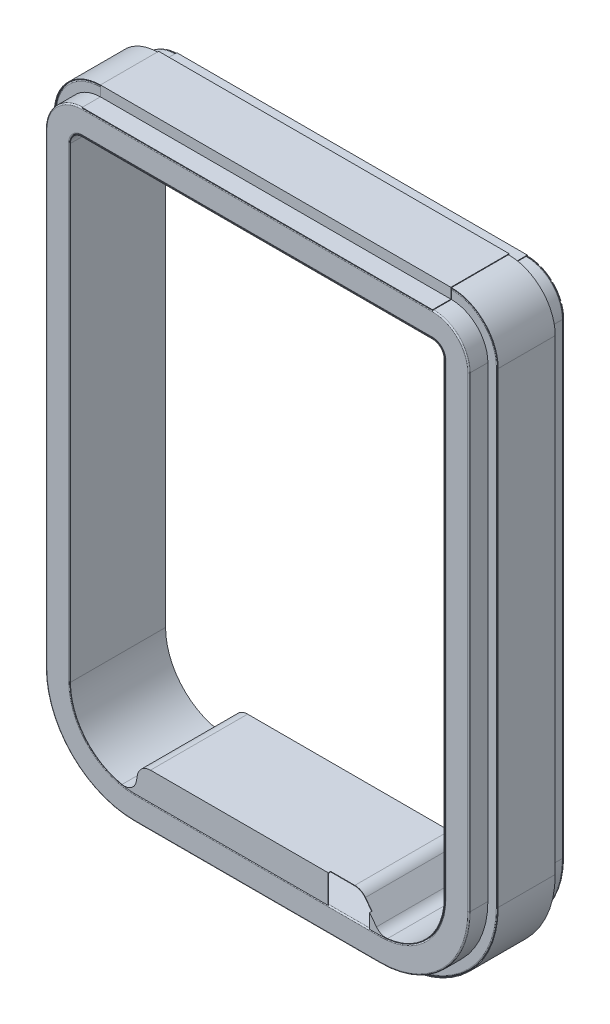
from build123d import *

# Parameters (mm, degrees)
BOSS_EXTRUDE4_DEPTH      = 4.7244
BOSS_EXTRUDE4_DEPTH_BACK = 5.1815999999999995
BOSS_EXTRUDE5_START      = -5.968999999999999
BOSS_EXTRUDE5_DEPTH      = 5.968999999999999
FILLET1_R                = 0.127
SKETCH4_W                = 0.5842
SKETCH4_H                = 0.1524000000000001
BOSS_EXTRUDE1_DEPTH      = 9.906
BOSS_EXTRUDE2_DEPTH      = 5.968999999999999
BOSS_EXTRUDE3_DEPTH      = 0.254
CUT_EXTRUDE1_DEPTH       = 0.254
EXTRUDE_THIN1_DEPTH      = 18.3388
FILLET6_R                = 1.27
FILLET7_R                = 1.27
CUT_EXTRUDE5_DEPTH       = 0.20320000000000002
FILLET11_R               = 1.3207999999999998
CUT_EXTRUDE6_DEPTH       = 0.1778
FILLET9_R                = 1.27
FILLET10_R               = 1.27
FILLET12_R               = 1.3208
FILLET13_R               = 1.3207999999999998
BOSS_EXTRUDE6_DEPTH      = 5.969
FILLET15_R               = 1.3208
BOSS_EXTRUDE7_START      = -0.0508
BOSS_EXTRUDE7_DEPTH      = 0.0508
SKETCH29_W               = 4.3288360759419255
SKETCH29_H               = 2.9608406959411457
CUT_EXTRUDE8_DEPTH       = 0.254


with BuildPart() as part:
    # Sketch15 → Boss-Extrude4 (new, two sides: drawn at the far end of the back side and taken through both)
    with BuildSketch(Plane.XY.offset(-BOSS_EXTRUDE4_DEPTH_BACK)):
        with BuildLine():
            Line((1.3716000000007786, 11.19492499805992), (1.37160000000078, 60.03912499805526))
            ThreePointArc((1.37160000000078, 60.03912499805526), (2.487523163680782, 62.73320183437779), (5.181600000003313, 63.84912499805778))
            Line((5.181600000003313, 63.84912499805778), (41.8591999999961, 63.84912499805778))
            ThreePointArc((41.8591999999961, 63.84912499805778), (44.553276836318645, 62.7332018343778), (45.669199999998646, 60.03912499805526))
            Line((45.669199999998646, 60.03912499805526), (45.669199999998646, 11.19492499805992))
            ThreePointArc((45.669199999998646, 11.19492499805992), (42.95378696837913, 4.63933802967944), (36.398199999998646, 1.9239249980599216))
            Line((36.398199999998646, 1.9239249980599216), (10.642600000000776, 1.9239249980599216))
            ThreePointArc((10.642600000000776, 1.9239249980599216), (4.087013031620294, 4.6393380296794415), (1.3716000000007786, 11.19492499805992))
        make_face()
        with BuildLine():
            Line((3.9115999999997113, 60.03912499805526), (3.9115999999997113, 11.19492499805992))
            ThreePointArc((3.9115999999997113, 11.19492499805992), (5.883064255833371, 6.435389253892517), (10.642600000000774, 4.463924998058857))
            Line((10.642600000000774, 4.463924998058857), (36.398199999998646, 4.463924998058857))
            ThreePointArc((36.398199999998646, 4.463924998058857), (41.15773574416605, 6.4353892538925175), (43.1291999999997, 11.19492499805992))
            Line((43.1291999999997, 11.19492499805992), (43.1291999999997, 60.03912499805526))
            ThreePointArc((43.1291999999997, 60.03912499805526), (42.75722561210556, 60.937150610164714), (41.8591999999961, 61.309124998058856))
            Line((41.8591999999961, 61.309124998058856), (5.181600000003313, 61.309124998058856))
            ThreePointArc((5.181600000003313, 61.309124998058856), (4.283574387893854, 60.937150610164714), (3.9115999999997113, 60.03912499805526))
        make_face(mode=Mode.SUBTRACT)
    extrude(amount=BOSS_EXTRUDE4_DEPTH + BOSS_EXTRUDE4_DEPTH_BACK)

    # Sketch16 → Boss-Extrude5 (add)
    with BuildSketch(Plane.XY.offset(2.7432000000000003).offset(BOSS_EXTRUDE5_START)):
        with BuildLine():
            Line((0.3556000000007834, 60.03912499805526), (0.3556000000007786, 11.194924998059921))
            ThreePointArc((0.3556000000007786, 11.194924998059921), (3.3685925419347615, 3.9209175399939094), (10.642600000000776, 0.9079249980599238))
            Line((10.642600000000776, 0.9079249980599238), (36.398199999998646, 0.9079249980599199))
            ThreePointArc((36.398199999998646, 0.9079249980599199), (43.67220745806466, 3.9209175399939067), (46.68519999999865, 11.194924998059921))
            Line((46.68519999999865, 11.194924998059921), (46.685199999998645, 60.03912499805526))
            ThreePointArc((46.685199999998645, 60.03912499805526), (45.27169732600418, 63.45162232406333), (41.8591999999961, 64.86512499805778))
            Line((41.8591999999961, 64.86512499805778), (5.181600000003313, 64.86512499805778))
            ThreePointArc((5.181600000003313, 64.86512499805778), (1.7691026739952513, 63.45162232406332), (0.3556000000007834, 60.03912499805526))
        make_face()
        with BuildLine():
            Line((41.8591999999961, 63.84912499805778), (5.181600000003313, 63.84912499805778))
            ThreePointArc((5.181600000003313, 63.84912499805778), (2.487523163680782, 62.73320183437779), (1.37160000000078, 60.03912499805526))
            Line((1.37160000000078, 60.03912499805526), (1.3716000000007786, 11.19492499805992))
            ThreePointArc((1.3716000000007786, 11.19492499805992), (4.087013031620294, 4.6393380296794415), (10.642600000000776, 1.9239249980599216))
            Line((10.642600000000776, 1.9239249980599216), (36.398199999998646, 1.92392499805992))
            ThreePointArc((36.398199999998646, 1.92392499805992), (42.95378696837913, 4.639338029679439), (45.669199999998646, 11.19492499805992))
            Line((45.669199999998646, 11.19492499805992), (45.66919999999864, 60.03912499805526))
            ThreePointArc((45.66919999999864, 60.03912499805526), (44.55327683631864, 62.733201834377795), (41.8591999999961, 63.84912499805778))
        make_face(mode=Mode.SUBTRACT)
    extrude(amount=BOSS_EXTRUDE5_DEPTH)

    # Fillet1
    fillet1_edges = [part.edges().sort_by_distance(p)[0] for p in [
        (42.95378696837913, 4.63933802967944, -5.1815999999999995),
        (1.7691026739952487, 63.451622324063315, 2.7432000000000003),
        (0.355600000000781, 35.61702499805759, 2.7432000000000003),
        (3.3685925419347615, 3.9209175399939067, 2.7432000000000003),
        (23.52039999999971, 0.9079249980599218, 2.7432000000000003),
        (43.67220745806466, 3.9209175399939067, 2.7432000000000003),
        (46.685199999998645, 35.61702499805759, 2.7432000000000003),
        (45.27169732600418, 63.45162232406333, 2.7432000000000003),
        (23.520399999999707, 64.86512499805778, 2.7432000000000003),
        (45.669199999998646, 35.61702499805759, -5.1815999999999995),
        (44.553276836318645, 62.733201834377795, -5.1815999999999995),
        (23.520399999999707, 63.84912499805778, -5.1815999999999995),
        (2.487523163680782, 62.73320183437779, -5.1815999999999995),
        (1.3716000000007793, 35.61702499805759, -5.1815999999999995),
        (4.283574387893855, 60.937150610164714, -5.1815999999999995),
        (23.520399999999707, 61.309124998058856, -5.1815999999999995),
        (42.75722561210556, 60.937150610164714, -5.1815999999999995),
        (43.1291999999997, 35.61702499805759, -5.1815999999999995),
        (41.15773574416605, 6.4353892538925175, -5.1815999999999995),
        (23.52039999999971, 4.463924998058857, -5.1815999999999995),
        (5.883064255833371, 6.435389253892516, -5.1815999999999995),
        (3.9115999999997113, 35.61702499805759, -5.1815999999999995),
        (4.0870130316202955, 4.63933802967944, -5.1815999999999995),
        (4.0870130316202955, 4.63933802967944, 4.7244),
        (23.52039999999971, 1.9239249980599216, 4.7244),
        (42.95378696837913, 4.63933802967944, 4.7244),
        (45.669199999998646, 35.61702499805759, 4.7244),
        (44.553276836318645, 62.733201834377795, 4.7244),
        (23.520399999999707, 63.84912499805778, 4.7244),
        (2.487523163680782, 62.73320183437779, 4.7244),
        (1.3716000000007793, 35.61702499805759, 4.7244),
        (4.283574387893855, 60.937150610164714, 4.7244),
        (3.9115999999997113, 35.61702499805759, 4.7244),
        (5.883064255833371, 6.435389253892516, 4.7244),
        (23.52039999999971, 4.463924998058857, 4.7244),
        (41.15773574416605, 6.4353892538925175, 4.7244),
        (43.1291999999997, 35.61702499805759, 4.7244),
        (42.75722561210556, 60.937150610164714, 4.7244),
        (23.520399999999707, 61.309124998058856, 4.7244),
        (23.52039999999971, 1.9239249980599216, -5.1815999999999995),
        (1.7691026739952487, 63.451622324063315, -3.225799999999999),
        (23.520399999999707, 64.86512499805778, -3.225799999999999),
        (45.27169732600418, 63.45162232406333, -3.225799999999999),
        (46.685199999998645, 35.61702499805759, -3.225799999999999),
        (43.67220745806466, 3.9209175399939067, -3.225799999999999),
        (23.52039999999971, 0.9079249980599218, -3.225799999999999),
        (3.3685925419347615, 3.9209175399939067, -3.225799999999999),
        (0.355600000000781, 35.61702499805759, -3.225799999999999),
    ]]
    fillet(fillet1_edges, radius=FILLET1_R)

    # Sweep1: sweep along a path in Sketch1
    with BuildLine() as sweep1_path:  # in the path sketch's own coordinates; laid on its plane below (add() does not lay a ready-made edge on the line's plane)
        add(Edge.make_bspline(
            [(23.5204, 0.7301249980627006), (4.876733945578098, 0.6234907723745157), (10.288008136508404, 0.5536080150748852), (8.118434294091632, 1.4309469259175354)],
            knots=[0, 0, 0, 0, 1, 1, 1, 1], degree=3))
    # Sketch2 → Sweep1 (sweep)
    with BuildSketch(Plane(origin=(23.520400000000002, 0.7301249980627008, -1.8796), x_dir=(0, 0, 1), z_dir=(-0.9999836435158218, -0.005719501798406666, 0))):
        Polygon((0.2921, -0.07619999999999998), (-0.29209999999999997, -0.07620000000000005), (-0.29209999999999997, 0.07619999999999993), (0.2921, 0.07620000000000003), align=None)
    sweep(path=Plane.XY.offset(-1.8796) * sweep1_path.line)

    # Sweep2: sweep along a path in Sketch3
    with BuildLine(Plane.XY.offset(-3.2512000000000003)) as sweep2_path:
        Line((28.1912, 5.064325118062801), (29.472500016994584, 5.064325118062801))
        ThreePointArc((29.472500016994584, 5.064325118062801), (30.62704291120851, 4.973598517206771), (31.75324281947112, 4.703645970798979))
        ThreePointArc((31.75324281947112, 4.703645970798979), (32.50175777951851, 4.524225320871167), (33.269110557648936, 4.4639249980628))
    # Sketch4 → Sweep2 (sweep)
    with BuildSketch(Plane(origin=(33.269110557648936, 0.7580041098484251, 0.10159999999999944), x_dir=(0, 0, 1), z_dir=(-1, 1.8e-16, 0))):
        with Locations((-3.3528, 3.7059208882143753)):
            Rectangle(SKETCH4_W, SKETCH4_H)
    sweep(path=sweep2_path.line)


with BuildPart() as body_2:
    # Sketch10 → Boss-Extrude1 (new body)
    with BuildSketch(Plane.XY.offset(4.7244)):
        with BuildLine():
            Line((36.373110157303266, 4.463971759490526), (34.544650972793214, 6.8472066344463265))
            ThreePointArc((34.544650972793214, 6.8472066344463265), (34.07203285071355, 7.23511523618504), (33.47658216175134, 7.373965694))
            Line((33.47658216175134, 7.373965694), (12.342341110152754, 7.373965694))
            ThreePointArc((12.342341110152754, 7.373965694), (11.48111051261952, 7.062432934165913), (11.018485686744414, 6.2720222351863715))
            Line((11.018485686744414, 6.2720222351863715), (10.68490915721032, 4.464057971054371))
            ThreePointArc((10.68490915721032, 4.464057971054371), (5.898046382280934, 6.42045414061447), (3.9115999999997113, 11.19492499805992))
            Line((3.9115999999997113, 11.19492499805992), (3.9115999999997113, 60.03912499805526))
            ThreePointArc((3.9115999999997113, 60.03912499805526), (4.283574387893854, 60.937150610164714), (5.181600000003313, 61.309124998058856))
            Line((5.181600000003313, 61.309124998058856), (41.8591999999961, 61.30912499805885))
            ThreePointArc((41.8591999999961, 61.30912499805885), (42.75722561210556, 60.937150610164714), (43.1291999999997, 60.03912499805526))
            Line((43.1291999999997, 60.03912499805526), (43.1291999999997, 11.19492499805992))
            ThreePointArc((43.1291999999997, 11.19492499805992), (41.14885686346667, 6.426526905870211), (36.373110157303266, 4.463971759490526))
        make_face()
        with BuildLine():
            Line((12.342341110152754, 7.424765693999999), (33.47658216175134, 7.4247656939999995))
            ThreePointArc((33.47658216175134, 7.4247656939999995), (34.09450268803288, 7.280675596267494), (34.58495545622876, 6.878128934085809))
            Line((34.58495545622876, 6.878128934085809), (36.398199999998646, 4.514724998058857))
            ThreePointArc((36.398199999998646, 4.514724998058857), (41.12181471968177, 6.4713102783767935), (43.078399999999704, 11.19492499805992))
            Line((43.078399999999704, 11.19492499805992), (43.078399999999704, 60.03912499805526))
            ThreePointArc((43.078399999999704, 60.03912499805526), (42.72130458762128, 60.90122958568044), (41.8591999999961, 61.25832499805885))
            Line((41.8591999999961, 61.25832499805885), (5.181600000003313, 61.25832499805886))
            ThreePointArc((5.181600000003313, 61.25832499805886), (4.319495412378127, 60.90122958568045), (3.9623999999997115, 60.03912499805526))
            Line((3.9623999999997115, 60.03912499805526), (3.9623999999997115, 11.194924998059921))
            ThreePointArc((3.9623999999997115, 11.194924998059921), (5.918985280317647, 6.4713102783767935), (10.642600000000776, 4.514724998058857))
            Line((10.642600000000776, 4.514724998058857), (10.968528878313913, 6.281239463155669))
            ThreePointArc((10.968528878313913, 6.281239463155669), (11.448611244788077, 7.101476980964626), (12.342341110152754, 7.424765693999999))
        make_face(mode=Mode.SUBTRACT)
    extrude(amount=-BOSS_EXTRUDE1_DEPTH)

    # Sketch12 → Boss-Extrude3 (add)
    with BuildSketch(Plane(origin=(0, 0, -5.1815999999999995), x_dir=(-1, 0, 0), z_dir=(0, 0, -1))):
        with BuildLine():
            Line((-13.698681579996874, 3.3027587723782483), (-33.34211842000255, 3.3027587723782483))
            Line((-33.34211842000255, 3.3027587723782483), (-34.36100899495642, 1.9747249980588601))
            Line((-34.36100899495642, 1.9747249980588601), (-36.398199999998646, 1.9747249980588601))
            ThreePointArc((-36.398199999998646, 1.9747249980588601), (-42.9178659438956, 4.675259054162967), (-45.6183999999997, 11.19492499805992))
            Line((-45.6183999999997, 11.19492499805992), (-45.6183999999997, 60.03912499805526))
            ThreePointArc((-45.6183999999997, 60.03912499805526), (-44.51735581183511, 62.697280809894266), (-41.8591999999961, 63.798324998058845))
            Line((-41.8591999999961, 63.798324998058845), (-5.181600000003313, 63.79832499805886))
            ThreePointArc((-5.181600000003313, 63.79832499805886), (-2.5234441881642957, 62.69728080989427), (-1.4223999999997097, 60.03912499805526))
            Line((-1.4223999999997097, 60.03912499805526), (-1.4223999999997128, 11.194924998059921))
            ThreePointArc((-1.4223999999997128, 11.194924998059921), (-4.1229340561038175, 4.6752590541629635), (-10.642600000000776, 1.974724998058857))
            Line((-10.642600000000776, 1.974724998058857), (-12.679791005043004, 1.9747249980588601))
            Line((-12.679791005043004, 1.9747249980588601), (-13.698681579996874, 3.3027587723782483))
        make_face()
        with BuildLine():
            Line((-10.642600000000773, 4.514724998058857), (-10.968528878313913, 6.281239463155669))
            ThreePointArc((-10.968528878313913, 6.281239463155669), (-11.448611244788076, 7.101476980964626), (-12.342341110152754, 7.424765693999999))
            Line((-12.342341110152754, 7.424765693999999), (-33.47658216175134, 7.424765693999996))
            ThreePointArc((-33.47658216175134, 7.424765693999996), (-34.09450268803288, 7.280675596267489), (-34.58495545622877, 6.87812893408581))
            Line((-34.58495545622877, 6.87812893408581), (-36.398199999998646, 4.514724998058857))
            ThreePointArc((-36.398199999998646, 4.514724998058857), (-41.12181471968177, 6.471310278376797), (-43.078399999999704, 11.19492499805992))
            Line((-43.078399999999704, 11.19492499805992), (-43.078399999999704, 60.03912499805526))
            ThreePointArc((-43.078399999999704, 60.03912499805526), (-42.72130458762129, 60.90122958568044), (-41.8591999999961, 61.25832499805885))
            Line((-41.8591999999961, 61.25832499805885), (-5.181600000003313, 61.25832499805886))
            ThreePointArc((-5.181600000003313, 61.25832499805886), (-4.319495412378126, 60.90122958568045), (-3.9623999999997097, 60.03912499805526))
            Line((-3.9623999999997097, 60.03912499805526), (-3.9623999999997115, 11.194924998059921))
            ThreePointArc((-3.9623999999997115, 11.194924998059921), (-5.9189852803176475, 6.471310278376794), (-10.642600000000773, 4.514724998058857))
        make_face(mode=Mode.SUBTRACT)
    extrude(amount=BOSS_EXTRUDE3_DEPTH)

    # Sketch13 → Cut-Extrude1 (cut)
    with BuildSketch(Plane(origin=(0, 0, -5.4356), x_dir=(-1, 0, 0), z_dir=(0, 0, -1))):
        with BuildLine():
            ThreePointArc((-42.371563974678054, 61.303942820308315), (-42.32193934313998, 61.32292921457257), (-42.271613231239506, 61.33996945176071))
            Line((-42.27161323123949, 61.339969451760716), (-42.99527085856865, 63.62254900929497))
            ThreePointArc((-42.995270858568645, 63.62254900929496), (-43.13390372682805, 63.57560842779556), (-43.2706042337149, 63.52330678565872))
            Line((-43.2706042337149, 63.52330678565872), (-42.371563974678054, 61.303942820308315))
        make_face()
        with BuildLine():
            ThreePointArc((-42.80649490873698, 61.02142501430002), (-42.781206942711265, 61.045198635333314), (-42.75532255181916, 61.06832145070897))
            Line((-42.75532255181915, 61.068321450708986), (-44.32774038548879, 62.87424280957892))
            ThreePointArc((-44.32774038548878, 62.87424280957891), (-44.3990438742148, 62.81054660701712), (-44.46870439695742, 62.74505763621656))
            Line((-44.46870439695742, 62.74505763621656), (-42.806494908736965, 61.021425014300036))
        make_face()
        with BuildLine():
            ThreePointArc((-43.15017470468083, 60.48146567887159), (-43.136142662445884, 60.52047560089743), (-43.12093214825755, 60.55904129139911))
            Line((-43.120932148257545, 60.55904129139913), (-45.33488171040668, 61.47133353313123))
            ThreePointArc((-45.33488171040668, 61.47133353313123), (-45.37678197112621, 61.36509698735497), (-45.415435906212934, 61.25763672116719))
            Line((-45.415435906212934, 61.25763672116719), (-43.150174704680836, 60.48146567887155))
        make_face()
        with BuildLine():
            ThreePointArc((-3.9198678518821986, 60.55904129139912), (-3.904657337693862, 60.52047560089743), (-3.8906252954589213, 60.48146567887159))
            Line((-3.8906252954589116, 60.48146567887156), (-1.625364093926815, 61.257636721167195))
            ThreePointArc((-1.6253640939268221, 61.257636721167195), (-1.6640180290135396, 61.365096987354974), (-1.705918289733078, 61.47133353313124))
            Line((-1.7059182897330722, 61.47133353313124), (-3.9198678518822083, 60.55904129139914))
        make_face()
        with BuildLine():
            ThreePointArc((-4.285477448320589, 61.06832145070898), (-4.259593057428484, 61.04519863533332), (-4.23430509140277, 61.021425014300036))
            Line((-4.234305091402779, 61.02142501430005), (-2.5720956031823268, 62.74505763621656))
            ThreePointArc((-2.5720956031823334, 62.74505763621655), (-2.641756125924955, 62.810546607017116), (-2.71305961465097, 62.8742428095789))
            Line((-2.713059614650959, 62.87424280957892), (-4.285477448320603, 61.06832145070899))
        make_face()
        with BuildLine():
            ThreePointArc((-4.769186768900246, 61.339969451760716), (-4.7188606569997695, 61.322929214572575), (-4.669236025461696, 61.30394282030832))
            Line((-4.669236025461699, 61.30394282030832), (-3.7701957664248513, 63.52330678565872))
            ThreePointArc((-3.7701957664248527, 63.52330678565871), (-3.906896273311701, 63.57560842779556), (-4.045529141571105, 63.62254900929496))
            Line((-4.045529141571101, 63.62254900929497), (-4.769186768900264, 61.339969451760716))
        make_face()
    extrude(amount=-CUT_EXTRUDE1_DEPTH, mode=Mode.SUBTRACT)

    # Fillet6
    fillet6_edges = [body_2.edges().sort_by_distance(p)[0] for p in [
        (10.642600000000774, 4.514724998058856, -0.35559999999999903),
        (36.398199999998646, 4.514724998058857, -0.3555999999999999),
    ]]
    fillet(fillet6_edges, radius=FILLET6_R)

    # Fillet7
    fillet7_edges = [body_2.edges().sort_by_distance(p)[0] for p in [
        (34.36100899495642, 1.9747249980588601, -5.308599999999999),
        (33.34211842000255, 3.3027587723782483, -5.308599999999999),
        (13.698681579996874, 3.3027587723782483, -5.308599999999999),
        (12.679791005043004, 1.9747249980588601, -5.308599999999999),
    ]]
    fillet(fillet7_edges, radius=FILLET7_R)

    # Sketch22 → Cut-Extrude5 (cut)
    with BuildSketch(Plane(origin=(0, 0, -5.4356), x_dir=(-1, 0, 0), z_dir=(0, 0, -1))):
        with BuildLine():
            Line((-3.9623999999997115, 11.194924998059921), (-3.962399999999709, 60.03912499805526))
            ThreePointArc((-3.962399999999709, 60.03912499805526), (-4.319495412378126, 60.90122958568045), (-5.181600000003313, 61.25832499805886))
            Line((-5.181600000003313, 61.25832499805886), (-41.8591999999961, 61.25832499805885))
            ThreePointArc((-41.8591999999961, 61.25832499805885), (-42.72130458762129, 60.90122958568044), (-43.078399999999704, 60.03912499805526))
            Line((-43.078399999999704, 60.03912499805526), (-43.078399999999704, 11.19492499805992))
            ThreePointArc((-43.078399999999704, 11.19492499805992), (-41.37714173308828, 6.741251092337529), (-37.13989179410485, 4.556027098365295))
            Line((-37.13989179410485, 4.556027098365295), (-37.13989179410485, 2.004605018724322))
            ThreePointArc((-37.13989179410485, 2.004605018724322), (-43.17502206937742, 4.942983645167978), (-45.6183999999997, 11.194924998059921))
            Line((-45.6183999999997, 11.194924998059921), (-45.6183999999997, 60.03912499805526))
            ThreePointArc((-45.6183999999997, 60.03912499805526), (-45.5673118280489, 60.65677482658432), (-45.415435906212934, 61.25763672116719))
            Line((-45.415435906212934, 61.25763672116719), (-43.15017470468084, 60.48146567887155))
            ThreePointArc((-43.15017470468084, 60.48146567887155), (-43.136142662445884, 60.52047560089742), (-43.12093214825754, 60.55904129139913))
            Line((-43.12093214825754, 60.55904129139913), (-45.33488171040668, 61.47133353313123))
            ThreePointArc((-45.33488171040668, 61.47133353313123), (-44.96773112627313, 62.153035799625165), (-44.46870439695742, 62.74505763621656))
            Line((-44.46870439695742, 62.74505763621656), (-42.806494908736965, 61.021425014300036))
            ThreePointArc((-42.806494908736965, 61.021425014300036), (-42.78120694271125, 61.04519863533333), (-42.75532255181914, 61.068321450708986))
            Line((-42.75532255181914, 61.068321450708986), (-44.32774038548878, 62.87424280957892))
            ThreePointArc((-44.32774038548878, 62.87424280957892), (-43.82612998687874, 63.242681001425396), (-43.2706042337149, 63.52330678565872))
            Line((-43.2706042337149, 63.52330678565872), (-42.37156397467805, 61.303942820308315))
            ThreePointArc((-42.37156397467805, 61.303942820308315), (-42.32193934313997, 61.322929214572575), (-42.271613231239485, 61.339969451760716))
            Line((-42.271613231239485, 61.339969451760716), (-42.99527085856865, 63.62254900929497))
            ThreePointArc((-42.99527085856865, 63.62254900929497), (-42.43399435320507, 63.7541211072788), (-41.8591999999961, 63.798324998058845))
            Line((-41.8591999999961, 63.798324998058845), (-5.181600000003313, 63.79832499805886))
            ThreePointArc((-5.181600000003313, 63.79832499805886), (-4.60680564686044, 63.75412110728904), (-4.0455291415582835, 63.622549009335394))
            Line((-4.0455291415582835, 63.622549009335394), (-4.769186768900266, 61.33996945176072))
            ThreePointArc((-4.769186768900266, 61.33996945176072), (-4.718860656999779, 61.32292921457258), (-4.669236025461696, 61.30394282030832))
            Line((-4.669236025461696, 61.30394282030832), (-3.770195766405055, 63.523306785707554))
            ThreePointArc((-3.770195766405055, 63.523306785707554), (-3.214670013221175, 63.24268100148712), (-2.7130596145904438, 62.874242809648415))
            Line((-2.7130596145904438, 62.874242809648415), (-4.285477448320599, 61.068321450708986))
            ThreePointArc((-4.285477448320599, 61.068321450708986), (-4.259593057428497, 61.045198635333335), (-4.234305091402787, 61.02142501430005))
            Line((-4.234305091402787, 61.02142501430005), (-2.5720956031146995, 62.74505763628668))
            ThreePointArc((-2.5720956031146995, 62.74505763628668), (-2.073068873769718, 62.15303579968904), (-1.7059182896131047, 61.471333533180676))
            Line((-1.7059182896131047, 61.471333533180676), (-3.9198678518822074, 60.55904129139914))
            ThreePointArc((-3.9198678518822074, 60.55904129139914), (-3.90465733769386, 60.52047560089743), (-3.8906252954589107, 60.48146567887156))
            Line((-3.8906252954589107, 60.48146567887156), (-1.6253640938012213, 61.25763672121022))
            ThreePointArc((-1.6253640938012213, 61.25763672121022), (-1.4734881719542443, 60.65677482660675), (-1.4223999999997097, 60.03912499805526))
            Line((-1.4223999999997097, 60.03912499805526), (-1.422399999999711, 11.19492499805992))
            ThreePointArc((-1.422399999999711, 11.19492499805992), (-3.6843119468684007, 5.14560144830207), (-9.360257185234452, 2.0643343848828732))
            Line((-9.360257185234452, 2.0643343848828732), (-9.360257185234454, 4.638960618547826))
            ThreePointArc((-9.360257185234454, 4.638960618547826), (-5.485499142386221, 6.948822928584266), (-3.9623999999997115, 11.194924998059921))
        make_face()
    extrude(amount=-CUT_EXTRUDE5_DEPTH, mode=Mode.SUBTRACT)

    # Fillet11
    fillet11_edges = [body_2.edges().sort_by_distance(p)[0] for p in [
        (36.373110157303266, 4.463971759490526, -0.22860000000000014),
        (10.68490915721032, 4.4640579710543715, -0.22860000000000014),
    ]]
    fillet(fillet11_edges, radius=FILLET11_R)

    # Sketch24 → Cut-Extrude6 (cut)
    with BuildSketch(Plane.XY.offset(-5.1815999999999995)):
        with BuildLine():
            Line((12.342341110152754, 7.373965694), (33.47658216175134, 7.373965694))
            ThreePointArc((33.47658216175134, 7.373965694), (34.07203285071355, 7.235115236185034), (34.54465097279322, 6.8472066344463265))
            Line((34.54465097279322, 6.8472066344463265), (35.95096918027386, 5.014195197414292))
            ThreePointArc((35.95096918027386, 5.014195197414292), (36.45548572135388, 4.614335692576441), (37.089091794104846, 4.500458967976456))
            Line((37.089091794104846, 4.500458967976456), (37.08909179410485, 1.974724998058858))
            Line((37.08909179410485, 1.974724998058858), (34.987358157779155, 1.9747249980588615))
            ThreePointArc((34.987358157779155, 1.9747249980588615), (34.425612224795934, 2.105715995997503), (33.97974607189058, 2.471667507071757))
            Line((33.97974607189058, 2.471667507071757), (33.72338134306839, 2.8058162633653527))
            ThreePointArc((33.72338134306839, 2.8058162633653527), (33.27751519016304, 3.1717677744396067), (32.715769257179815, 3.3027587723782483))
            Line((32.715769257179815, 3.3027587723782483), (14.32503074281961, 3.3027587723782488))
            ThreePointArc((14.32503074281961, 3.3027587723782488), (13.763284809836389, 3.1717677744396067), (13.317418656931036, 2.8058162633653523))
            Line((13.317418656931036, 2.8058162633653523), (13.061053928108842, 2.4716675070717558))
            ThreePointArc((13.061053928108842, 2.4716675070717558), (12.61518777520349, 2.1057159959975014), (12.05344184222027, 1.9747249980588593))
            Line((12.05344184222027, 1.9747249980588593), (10.642600000000776, 1.9747249980588566))
            ThreePointArc((10.642600000000776, 1.9747249980588566), (10.025444515262418, 1.9954028828804056), (9.411057185234457, 2.0573437899164286))
            Line((9.411057185234457, 2.0573437899164286), (9.411057185234455, 4.578717419681601))
            ThreePointArc((9.411057185234455, 4.578717419681601), (10.372394460253485, 4.8110245607586775), (10.902925614078894, 5.6456937520896515))
            Line((10.902925614078894, 5.6456937520896515), (11.018485686744414, 6.2720222351863715))
            ThreePointArc((11.018485686744414, 6.2720222351863715), (11.48111051261952, 7.062432934165913), (12.342341110152754, 7.373965694))
        make_face()
    extrude(amount=-CUT_EXTRUDE6_DEPTH, mode=Mode.SUBTRACT)

    # Fillet9
    # the kernel refuses this fillet: 1.27 mm, written as the material it adds along each edge
    with BuildSketch(Plane(origin=(37.13989179410485, 6.278738914090447, -5.2324), x_dir=(1, 0, 0), z_dir=(0, -1, 0))) as fillet9_piece_1_section:
        with BuildLine():
            CenterArc((0.6890847262900621, -1.2699999999999996), FILLET9_R, 90, 32.859880379060954)
            Line((1.33582e-12, -0.20320000000206662), (0, 0))
            Line((0, 0), (0.6890847262900621, 0))
        make_face()
    fillet9_piece_1 = extrude(amount=5.996845711091283, mode=Mode.PRIVATE)
    fillet9_piece_1 = fillet9_piece_1 - Plane(origin=(36.39819999999865, 11.194924998059907, -5.281822510665266), x_dir=(-1.06e-15, -1, 0), z_dir=(0, 0, 1)) * Cylinder(6.68020000000105, 15, mode=Mode.PRIVATE)
    fillet9_piece_1 = fillet9_piece_1 & Plane(origin=(36.39819999999864, 11.194924998059921, -5.281822510665266), x_dir=(7.7e-16, -1, 0), z_dir=(0, 0, 1)) * Cylinder(9.220200000001062, 15, mode=Mode.PRIVATE)
    add(fillet9_piece_1)
    with BuildSketch(Plane(origin=(9.36025718523445, 0.34162256915772815, -5.2324), x_dir=(-1, 6.9e-16, 0), z_dir=(6.9e-16, 1, 0))) as fillet9_piece_2_section:
        with BuildLine():
            CenterArc((0.6890847262900603, -1.2699999999999996), FILLET9_R, 90, 32.859880379060925)
            Line((1.33404e-12, -0.20320000000206573), (0, 0))
            Line((0, 0), (0.6890847262900603, 0))
        make_face()
    fillet9_piece_2 = extrude(amount=6.020049865115247, mode=Mode.PRIVATE)
    fillet9_piece_2 = fillet9_piece_2 - Plane(origin=(10.642600000000773, 11.194924998059918, -5.281822510665266), x_dir=(-1, 5.3e-16, 0), z_dir=(0, 0, 1)) * Cylinder(6.6802000000010615, 15, mode=Mode.PRIVATE)
    fillet9_piece_2 = fillet9_piece_2 & Plane(origin=(10.642600000000776, 11.194924998059921, -5.281822510665266), x_dir=(-1, 0, 0), z_dir=(0, 0, 1)) * Cylinder(9.220200000001064, 15, mode=Mode.PRIVATE)
    add(fillet9_piece_2)

    # Fillet10
    fillet10_edges = [body_2.edges().sort_by_distance(p)[0] for p in [
        (9.360257185234452, 3.35164750171535, -5.4356),
        (37.13989179410485, 3.280316058544808, -5.4356),
    ]]
    fillet(fillet10_edges, radius=FILLET10_R)

    # Fillet12
    # the kernel refuses this fillet: 1.3208 mm, written as the material it adds along each edge
    with BuildSketch(Plane(origin=(37.08909179410484, 6.15511837401748, -5.3594), x_dir=(-1, -2.81e-15, -1.34e-15), z_dir=(2.81e-15, -1, 0))) as fillet12_piece_1_section:
        with BuildLine():
            CenterArc((0.6618637624164077, -1.3208000000000002), FILLET12_R, 89.99999999999993, 30.07334764497395)
            Line((-2.4e-16, -0.1778000000000013), (-0.01323727524832939, -0.1549400000000016))
            ThreePointArc((-0.01323727524832939, -0.1549400000000016), (-0.02641599999999767, -0.0889000000000006), (-0.02641599999999755, 4e-17))
            Line((-0.02641599999999755, 4e-17), (4e-17, 0.02641600000000022))
            Line((4e-17, 0.02641600000000022), (0.6618637624164094, 0.02641600000000022))
            Line((0.6618637624164094, 0.02641600000000022), (0.6618637624164094, 0))
        make_face()
    fillet12_piece_1 = extrude(amount=5.809131251180192, mode=Mode.PRIVATE)
    fillet12_piece_1 = fillet12_piece_1 & Plane(origin=(36.398199999999, 11.19492499806, -5.325175273397479), x_dir=(0, -1, 0), z_dir=(0, 0, 1)) * Cylinder(9.220200000001, 15, mode=Mode.PRIVATE)
    fillet12_piece_1 = fillet12_piece_1 - Plane(origin=(36.99888574959797, 5.818174988040875, -5.3251752733974795), x_dir=(0.11102838150146087, -0.9938172359650269, 0), z_dir=(0, 0, -1)) * Cylinder(1.3207999999999998, 15, mode=Mode.PRIVATE)
    add(fillet12_piece_1)
    with BuildSketch(Plane(origin=(9.411057185234458, 0.4026843838754095, -5.3594), x_dir=(1, 7e-16, -1.34e-15), z_dir=(-7e-16, 1, 0))) as fillet12_piece_2_section:
        with BuildLine():
            CenterArc((0.6618637624164059, -1.3208000000000002), FILLET12_R, 89.99999999999993, 30.07334764497388)
            Line((-2.4e-16, -0.1778000000000004), (-0.01323727524832762, -0.15494000000000072))
            ThreePointArc((-0.01323727524832762, -0.15494000000000072), (-0.02641599999999945, -0.08889999999999972), (-0.02641599999999933, 4e-17))
            Line((-0.02641599999999933, 4e-17), (4e-17, 0.02641600000000022))
            Line((4e-17, 0.02641600000000022), (0.6618637624164077, 0.02641600000000022))
            Line((0.6618637624164077, 0.02641600000000022), (0.6618637624164077, 0))
        make_face()
    fillet12_piece_2 = extrude(amount=5.83069244184721, mode=Mode.PRIVATE)
    fillet12_piece_2 = fillet12_piece_2 & Plane(origin=(10.642600000001, 11.19492499806, -5.3251348947729), x_dir=(-1, 0, 0), z_dir=(0, 0, 1)) * Cylinder(9.220200000001, 15, mode=Mode.PRIVATE)
    fillet12_piece_2 = fillet12_piece_2 - Plane(origin=(9.604048594885807, 5.885341679291371, -5.3251348947729005), x_dir=(-0.19196173988295398, -0.9814024100342882, 0), z_dir=(0, 0, -1)) * Cylinder(1.3207999999999998, 15, mode=Mode.PRIVATE)
    add(fillet12_piece_2)

    # Fillet13
    fillet13_edges = [body_2.edges().sort_by_distance(p)[0] for p in [
        (9.411057185234457, 3.3180306047990147, -5.1815999999999995),
        (37.089091794104846, 3.250552748427415, -5.1815999999999995),
    ]]
    fillet(fillet13_edges, radius=FILLET13_R)

    # Sketch28 → Boss-Extrude7 (add)
    with BuildSketch(Plane.XY.offset(4.7244).offset(BOSS_EXTRUDE7_START)):
        with BuildLine():
            Line((33.47658216175134, 7.373965693999997), (12.342341110152754, 7.373965694))
            ThreePointArc((12.342341110152754, 7.373965694), (11.48111051261952, 7.062432934165913), (11.018485686744414, 6.2720222351863715))
            Line((11.018485686744414, 6.2720222351863715), (10.902925614078894, 5.6456937520896515))
            ThreePointArc((10.902925614078894, 5.6456937520896515), (10.34720101361603, 4.793445565855931), (9.350505528848402, 4.589105376118084))
            ThreePointArc((9.350505528848402, 4.589105376118084), (9.993527922063048, 4.495293184470765), (10.642600000000773, 4.463924998058857))
            Line((10.642600000000773, 4.463924998058857), (36.398199999998646, 4.463924998058857))
            ThreePointArc((36.398199999998646, 4.463924998058857), (36.772444932727474, 4.474337097411563), (37.14553203588511, 4.505541182778273))
            ThreePointArc((37.14553203588511, 4.505541182778273), (36.7778047002469, 4.516009173093401), (36.427228031688436, 4.627494471044626))
            ThreePointArc((36.427228031688436, 4.627494471044626), (36.166335702507226, 4.792810146099636), (35.95096918027386, 5.014195197414292))
            Line((35.95096918027386, 5.014195197414292), (34.54465097279322, 6.8472066344463265))
            ThreePointArc((34.54465097279322, 6.8472066344463265), (34.07203285071355, 7.235115236185034), (33.47658216175134, 7.373965693999997))
        make_face()
    extrude(amount=BOSS_EXTRUDE7_DEPTH)

    # Sketch29 → Cut-Extrude8 (cut)
    with BuildSketch(Plane.XY.offset(4.7244)):
        with Locations((33.10791124781787, 5.94434534602943)):
            Rectangle(SKETCH29_W, SKETCH29_H)
    extrude(amount=-CUT_EXTRUDE8_DEPTH, mode=Mode.SUBTRACT)


with BuildPart() as body_3:
    # Sketch11 → Boss-Extrude2 (new body)
    with BuildSketch(Plane.XY.offset(2.7432000000000003)):
        with BuildLine():
            Line((46.74869999999864, 11.194924998059921), (46.748699999998635, 60.03912499805526))
            ThreePointArc((46.748699999998635, 60.03912499805526), (45.31659860660952, 63.496523604668674), (41.8591999999961, 64.92862499805778))
            Line((41.8591999999961, 64.92862499805778), (5.181600000003313, 64.92862499805778))
            ThreePointArc((5.181600000003313, 64.92862499805778), (1.7242013933899023, 63.49652360466867), (0.29210000000078323, 60.03912499805526))
            Line((0.29210000000078323, 60.03912499805526), (0.29210000000077824, 11.194924998059921))
            ThreePointArc((0.29210000000077824, 11.194924998059921), (3.323691261329415, 3.876016259388562), (10.642600000000776, 0.8444249980599245))
            Line((10.642600000000776, 0.8444249980599245), (36.398199999998646, 0.8444249980599187))
            ThreePointArc((36.398199999998646, 0.8444249980599187), (43.71710873867001, 3.8760162593885594), (46.74869999999864, 11.194924998059921))
        make_face()
        with BuildLine():
            Line((5.181600000003313, 64.86512499805778), (41.8591999999961, 64.86512499805778))
            ThreePointArc((41.8591999999961, 64.86512499805778), (45.27169732600417, 63.45162232406333), (46.68519999999864, 60.03912499805526))
            Line((46.68519999999864, 60.03912499805526), (46.68519999999865, 11.194924998059921))
            ThreePointArc((46.68519999999865, 11.194924998059921), (43.67220745806466, 3.920917539993905), (36.398199999998646, 0.9079249980599187))
            Line((36.398199999998646, 0.9079249980599187), (10.642600000000776, 0.9079249980599238))
            ThreePointArc((10.642600000000776, 0.9079249980599238), (3.3685925419347615, 3.9209175399939094), (0.3556000000007782, 11.194924998059921))
            Line((0.3556000000007782, 11.194924998059921), (0.3556000000007834, 60.03912499805526))
            ThreePointArc((0.3556000000007834, 60.03912499805526), (1.7691026739952513, 63.45162232406332), (5.181600000003313, 64.86512499805778))
        make_face(mode=Mode.SUBTRACT)
    extrude(amount=-BOSS_EXTRUDE2_DEPTH)

    # Sketch26 → Boss-Extrude6 (add)
    with BuildSketch(Plane.XY.offset(2.7432000000000003)):
        with BuildLine():
            Line((10.642600000000776, 0.8444249980599245), (33.55700704464518, 0.8444249980599208))
            Line((33.55700704464518, 0.8444249980599208), (29.861542704036108, 0.4888249980599205))
            Line((29.861542704036108, 0.4888249980599205), (10.642600000000773, 0.4888249980599252))
            ThreePointArc((10.642600000000773, 0.4888249980599252), (9.700130386000406, 0.5303889914309448), (8.764978618982358, 0.6547582460800262))
            Line((8.764978618982358, 0.6547582460800262), (7.576207297395501, 1.3090721747872105))
            ThreePointArc((7.576207297395501, 1.3090721747872105), (9.091901673001654, 0.9612460433221859), (10.642600000000776, 0.8444249980599245))
        make_face()
    extrude(amount=-BOSS_EXTRUDE6_DEPTH)

    # Fillet15
    # the kernel refuses this fillet: 1.3208 mm, written as the material it adds along each edge
    with BuildSketch(Plane(origin=(7.5762072973955, 1.3090721747872098, 2.7432000000000003), x_dir=(-0.9533392888093332, 0.3019009778263644, 0), z_dir=(0, 0, -1))) as fillet15_piece_1:
        with BuildLine():
            CenterArc((0.1302861552300364, -1.320776884580841), FILLET15_R, 90.33897730301834, 10.918118033691414)
            Line((-0.12754956117091265, -0.02538760588967892), (0, 0))
            ThreePointArc((0, 0), (0.06123599568192398, -0.00018114487129387), (0.12247199136385012, 0))
        make_face()
    extrude(amount=5.969)
    with BuildSketch(Plane(origin=(33.55700704464518, 0.8444249980599208, 2.7432000000000003), x_dir=(1, -2.276e-14, 0), z_dir=(0, 0, -1))) as fillet15_piece_2:
        with BuildLine():
            CenterArc((FILLET15_R * 0.0480021711456, FILLET15_R), FILLET15_R, 264.5035754168658, 5.496424583132921)
            Line((-FILLET15_R * 0.0477814656817, FILLET15_R * 0.00459782252793), (0, 0))
            Line((0, 0), (FILLET15_R * 0.0480021711456, 0))
        make_face()
    extrude(amount=5.969)
    # the kernel refuses this fillet: 1.3208 mm, written as the material it takes off along each edge
    with BuildSketch(Plane(origin=(29.861542704036108, 0.4888249980599205, 2.901703169122724), x_dir=(-1, 1.75e-15, 0), z_dir=(0, 0, -1))) as fillet15_2_piece_1:
        with BuildLine():
            CenterArc((FILLET15_R * 0.0480021711456, FILLET15_R), FILLET15_R, 264.50357541686685, 5.496424583133091)
            Line((-FILLET15_R * 0.0477814656817, FILLET15_R * 0.00459782252793), (0, 0))
            Line((0, 0), (FILLET15_R * 0.0480021711456, 0))
        make_face()
    extrude(amount=6.286006338245448, mode=Mode.SUBTRACT)
    with BuildSketch(Plane(origin=(8.764978618982354, 0.6547582460800284, 3.3444657589618183), x_dir=(-0.8760634757561021, 0.4821957967943493, 0), z_dir=(0, 0, -1))) as fillet15_2_piece_2:
        with BuildLine():
            CenterArc((0.22518263431337182, 1.3207999999999998), FILLET15_R, 249.9846392064164, 20.015360793583625)
            ThreePointArc((-0.22689030156019888, 0.07977514100214318), (-0.11366917060840492, 0.03925043058805006), (0, 0))
            Line((0, 0), (0.22518263431337257, 0))
        make_face()
    extrude(amount=7.171531517923636, mode=Mode.SUBTRACT)


with BuildPart() as body_4:
    # Sketch14 → Extrude-Thin1 (new, symmetric)
    with BuildSketch(Plane(origin=(23.52039999999966, 0.7301249980626832, 1.3970000000000014), x_dir=(0, 0, 1), z_dir=(-1, -1.1e-15, 0))):
        Polygon((-6.591638916356301, 63.11899999999508), (-4.622800000000001, 63.11899999999508), (-4.622800000000001, 64.19849999999508), (1.346199999999999, 64.19849999999508), (1.3461999999999992, 63.11899999999508), (3.3273999999999986, 63.11899999999508), (3.3273999999999986, 63.18249999999508), (1.409699999999999, 63.18249999999508), (1.409699999999999, 64.26199999999508), (-4.686300000000001, 64.26199999999508), (-4.686300000000001, 63.18249999999508), (-6.591638916356301, 63.18249999999508), align=None)
    extrude(amount=EXTRUDE_THIN1_DEPTH, both=True)


solid = Compound([part.part, body_2.part, body_3.part, body_4.part])
